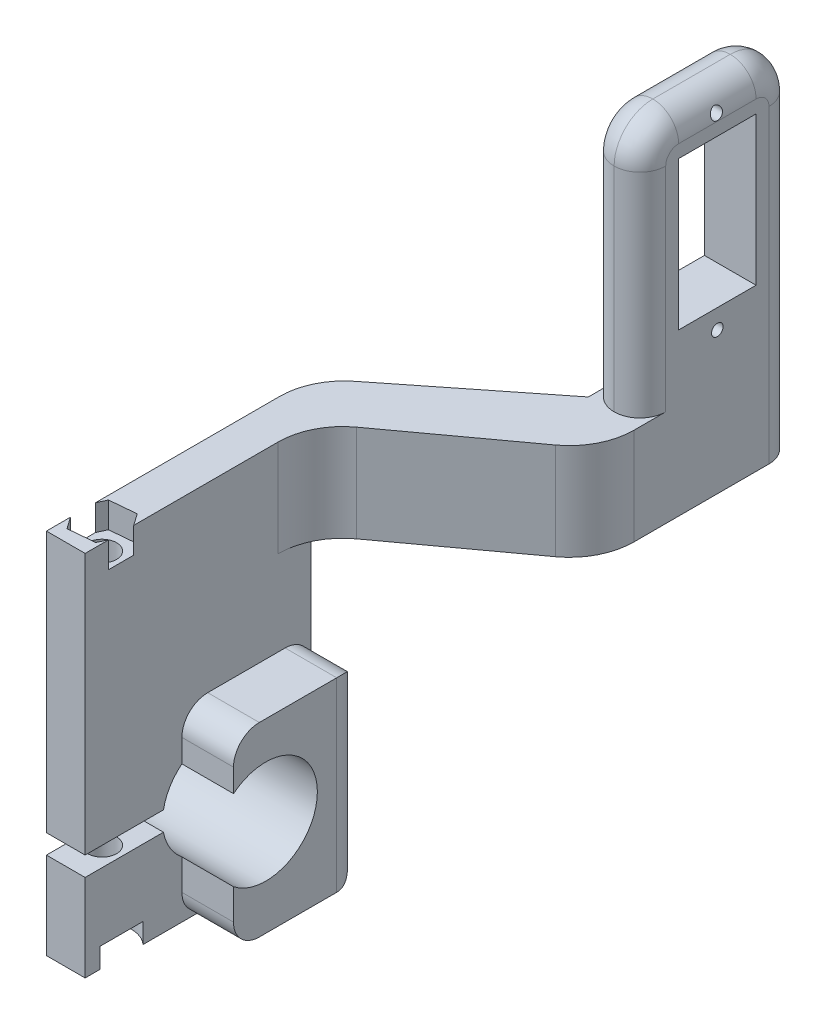
from build123d import *

# Parameters (mm, degrees)
SKETCH1_R                                        = 0.9
SKETCH1_W                                        = 12
SKETCH1_H                                        = 23
BOSS_EXTRUDE1_DEPTH                              = 32
CBORE_FOR_M4_PAN_HEAD_MACHINE_SCREW2_D           = 4.5
CBORE_FOR_M4_PAN_HEAD_MACHINE_SCREW2_CBORE_D     = 9
CBORE_FOR_M4_PAN_HEAD_MACHINE_SCREW2_CBORE_DEPTH = 3.1
CUT_EXTRUDE2_DEPTH                               = 4
SKETCH9_W                                        = 35
SKETCH9_H                                        = 57
CUT_EXTRUDE3_DEPTH                               = 26
SKETCH10_W                                       = 24
SKETCH10_H                                       = 54
CUT_EXTRUDE4_DEPTH                               = 24
BOSS_EXTRUDE2_DEPTH                              = 8
BOSS_EXTRUDE2_DEPTH_BACK                         = 14
FILLET3_R                                        = 4
FILLET4_R                                        = 6
FILLET5_R                                        = 4
CUT_EXTRUDE5_DEPTH                               = 86.654277555
FILLET6_R                                        = 10


with BuildPart() as part:
    # Sketch1 → Boss-Extrude1 (new body)
    with BuildSketch(Plane(origin=(0, 0, 0), x_dir=(0, 0, -1), z_dir=(1, 0, 0))):
        with BuildLine():
            Line((-55.350295908, -42.411439664), (-43.208412731, -42.411439664))
            ThreePointArc((-43.208412731, -42.411439664), (-27.350295908, -43.911439664), (-43.208412731, -45.411439664))
            Line((-43.208412731, -45.411439664), (-55.350295908, -45.411439664))
            Line((-55.350295908, -45.411439664), (-55.350295908, -58.911439664))
            Line((-55.350295908, -58.911439664), (-20.350295908, -58.911439664))
            Line((-20.350295908, -58.911439664), (-20.350295908, -16.911439664))
            Line((-20.350295908, -16.911439664), (28.649704092, -16.911439664))
            Line((28.649704092, -16.911439664), (28.649704092, 37.088560336))
            Line((28.649704092, 37.088560336), (4.649704092, 37.088560336))
            Line((4.649704092, 37.088560336), (4.649704092, -1.911439664))
            Line((4.649704092, -1.911439664), (-55.350295908, -1.911439664))
            Line((-55.350295908, -1.911439664), (-55.350295908, -28.911439664))
            Line((-55.350295908, -28.911439664), (-55.350295908, -42.411439664))
        make_face()
        with Locations((16.649704092, 34.088560336)):
            Circle(SKETCH1_R, mode=Mode.SUBTRACT)
        with Locations((16.649704092, 5.088560336)):
            Circle(SKETCH1_R, mode=Mode.SUBTRACT)
        with Locations((16.649704092, 19.588560336)):
            Rectangle(SKETCH1_W, SKETCH1_H, mode=Mode.SUBTRACT)
    extrude(amount=BOSS_EXTRUDE1_DEPTH)

    # CBORE for M4 Pan Head Machine Screw2 (through all)
    with Locations(Plane(origin=(0, -58.911439664, 0), x_dir=(-1, 0, 0), z_dir=(0, -1, 0))):
        with Locations((-3, -49.720295908)):
            CounterBoreHole(CBORE_FOR_M4_PAN_HEAD_MACHINE_SCREW2_D / 2, CBORE_FOR_M4_PAN_HEAD_MACHINE_SCREW2_CBORE_D / 2, CBORE_FOR_M4_PAN_HEAD_MACHINE_SCREW2_CBORE_DEPTH)

    # Sketch7 → Cut-Extrude2 (cut)
    with BuildSketch(Plane(origin=(0, -1.911439664, 0), x_dir=(1, 0, 0), z_dir=(0, 1, 0))):
        Polygon((7.082253493, -49.348086624), (4.718784051, -45.998856036), (0.636530558, -46.37106532), (-1.082253493, -50.092505192), (1.281215949, -53.441735779), (5.363469442, -53.069526496), align=None)
    extrude(amount=-CUT_EXTRUDE2_DEPTH, mode=Mode.SUBTRACT)

    # Sketch9 → Cut-Extrude3 (cut)
    with BuildSketch(Plane(origin=(32, 0, 0), x_dir=(0, 0, -1), z_dir=(1, 0, 0))):
        with Locations((-37.850295908, -30.411439664)):
            Rectangle(SKETCH9_W, SKETCH9_H)
    extrude(amount=-CUT_EXTRUDE3_DEPTH, mode=Mode.SUBTRACT)

    # Sketch10 → Cut-Extrude4 (cut)
    with BuildSketch(Plane.ZY):
        with Locations((-16.649704092, 10.088560336)):
            Rectangle(SKETCH10_W, SKETCH10_H)
    extrude(amount=-CUT_EXTRUDE4_DEPTH, mode=Mode.SUBTRACT)

    # Sketch11 → Boss-Extrude2 (add, two sides: drawn at the far end of the back side and taken through both)
    with BuildSketch(Plane.ZY.offset(-BOSS_EXTRUDE2_DEPTH_BACK)):
        with BuildLine():
            Line((20.350295908, -30.109144798), (40.350295908, -30.109144798))
            Line((40.350295908, -30.109144798), (40.350295908, -37.666441665))
            ThreePointArc((40.350295908, -37.666441665), (27.350295908, -43.911439664), (40.350295908, -50.156437662))
            Line((40.350295908, -50.156437662), (40.350295908, -58.911439664))
            Line((40.350295908, -58.911439664), (20.350295908, -58.911439664))
            Line((20.350295908, -58.911439664), (20.350295908, -30.109144798))
        make_face()
    extrude(amount=BOSS_EXTRUDE2_DEPTH + BOSS_EXTRUDE2_DEPTH_BACK)

    # Fillet3
    fillet3_edges = [part.edges().sort_by_distance(p)[0] for p in [
        (3, -58.911439664, 20.350295908),
        (14, -44.510292231, 20.350295908),
        (-4, -30.109144798, 20.350295908),
        (10, -30.109144798, 20.350295908),
        (-4, -30.109144798, 40.350295908),
        (10, -30.109144798, 40.350295908),
        (-4, -58.911439664, 40.350295908),
        (10, -58.911439664, 40.350295908),
        (-8, -44.510292231, 20.350295908),
    ]]
    fillet(fillet3_edges, radius=FILLET3_R)

    # Fillet4
    fillet4_edges = [part.edges().sort_by_distance(p)[0] for p in [
        (28, 37.088560336, -4.649704092),
        (28, 37.088560336, -28.649704092),
    ]]
    fillet(fillet4_edges, radius=FILLET4_R)

    # Fillet5
    # the kernel refuses this fillet: 4 mm, written as the material it takes off along each edge
    with BuildSketch(Plane(origin=(32, 31.088560336, -4.649704092), x_dir=(-1, 0, 0), z_dir=(0, -1, 0)), Plane(origin=(24, -1.911439664, -4.649704092), x_dir=(1, 0, 0), z_dir=(0, 1, 0))) as fillet5_piece_1:
        with BuildLine():
            CenterArc((FILLET5_R, FILLET5_R), FILLET5_R, 180, 90)
            Line((0, FILLET5_R), (0, 0))
            Line((0, 0), (FILLET5_R, 0))
        make_face()
    extrude(amount=33, mode=Mode.SUBTRACT)
    with BuildSketch(Plane(origin=(32, 31.088560336, -10.649704092), x_dir=(0, 0, 1), z_dir=(0, -1, 0))) as fillet5_piece_2:
        with BuildLine():
            CenterArc((6 - FILLET5_R, FILLET5_R), FILLET5_R, 270, 90)
            Line((6 - FILLET5_R, 0), (6, 0))
            Line((6, 0), (6, FILLET5_R))
        make_face()
    revolve(axis=Axis((32, 31.088560336, -10.649704092), (-1, 0, 0)), revolution_arc=90, mode=Mode.SUBTRACT)
    with BuildSketch(Plane(origin=(32, 37.088560336, -22.649704092), x_dir=(0, -1, 0), z_dir=(0, 0, 1)), Plane(origin=(24, 37.088560336, -10.649704092), x_dir=(0, -1, 0), z_dir=(0, 0, -1))) as fillet5_piece_3:
        with BuildLine():
            CenterArc((FILLET5_R, -FILLET5_R), FILLET5_R, 90, 90)
            Line((0, -FILLET5_R), (0, 0))
            Line((0, 0), (FILLET5_R, 0))
        make_face()
    extrude(amount=12, mode=Mode.SUBTRACT)
    with BuildSketch(Plane(origin=(32, 31.088560336, -22.649704092), x_dir=(0, 1, 0), z_dir=(0, 0, 1))) as fillet5_piece_4:
        with BuildLine():
            CenterArc((6 - FILLET5_R, FILLET5_R), FILLET5_R, 270, 90)
            Line((6, FILLET5_R), (6, 0))
            Line((6, 0), (6 - FILLET5_R, 0))
        make_face()
    revolve(axis=Axis((32, 31.088560336, -22.649704092), (-1, 0, 0)), revolution_arc=90, mode=Mode.SUBTRACT)
    with BuildSketch(Plane(origin=(24, 31.088560336, -10.649704092), x_dir=(0, 0, 1), z_dir=(0, -1, 0))) as fillet5_piece_5:
        with BuildLine():
            CenterArc((6 - FILLET5_R, -FILLET5_R), FILLET5_R, 0, 90)
            Line((6, -FILLET5_R), (6, 0))
            Line((6, 0), (6 - FILLET5_R, 0))
        make_face()
    revolve(axis=Axis((24, 31.088560336, -10.649704092), (-1, 0, 0)), revolution_arc=90, mode=Mode.SUBTRACT)
    with BuildSketch(Plane(origin=(24, 31.088560336, -22.649704092), x_dir=(0, 1, 0), z_dir=(0, 0, 1))) as fillet5_piece_6:
        with BuildLine():
            CenterArc((6 - FILLET5_R, -FILLET5_R), FILLET5_R, 0, 90)
            Line((6, -FILLET5_R), (6, 0))
            Line((6, 0), (6 - FILLET5_R, 0))
        make_face()
    revolve(axis=Axis((24, 31.088560336, -22.649704092), (-1, 0, 0)), revolution_arc=90, mode=Mode.SUBTRACT)
    with BuildSketch(Plane(origin=(32, -26.911439664, -28.649704092), x_dir=(0, 0, 1), z_dir=(0, 1, 0)), Plane(origin=(24, 31.088560336, -28.649704092), x_dir=(0, 0, 1), z_dir=(0, -1, 0))) as fillet5_piece_7:
        with BuildLine():
            CenterArc((FILLET5_R, -FILLET5_R), FILLET5_R, 90, 90)
            Line((0, -FILLET5_R), (0, 0))
            Line((0, 0), (FILLET5_R, 0))
        make_face()
    extrude(amount=58, mode=Mode.SUBTRACT)

    # Sketch13 → Cut-Extrude5 (cut, through all)
    with BuildSketch(Plane(origin=(0, -1.911439664, 0), x_dir=(1, 0, 0), z_dir=(0, 1, 0))):
        Polygon((6, -20.350295908), (32, -1.350295908), (32, -20.350295908), align=None)
        Polygon((0, 4.649704092), (24, 4.649704092), (0, -14.350295908), align=None)
    extrude(amount=-CUT_EXTRUDE5_DEPTH, mode=Mode.SUBTRACT)

    # Fillet6
    fillet6_edges = [part.edges().sort_by_distance(p)[0] for p in [
        (6, -9.411439664, 20.350295908),
        (32, -9.411439664, 1.350295908),
        (0, -9.411439664, 14.350295908),
    ]]
    fillet(fillet6_edges, radius=FILLET6_R)


solid = part.part
